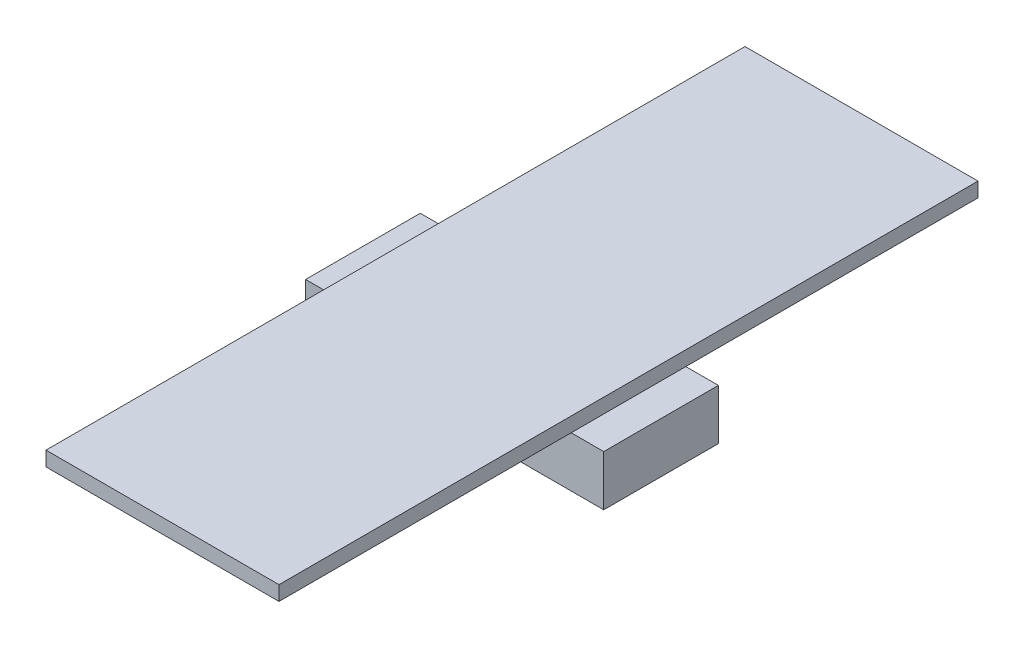
from build123d import *

# Parameters (mm, degrees)
SKETCH1_W           = 130
SKETCH1_H           = 50
BOSS_EXTRUDE1_DEPTH = 22
SKETCH2_RX          = 15.461746976
SKETCH2_RY          = 5.884694745
CUT_EXTRUDE1_DEPTH  = 85.905830189
SKETCH3_W           = 101.6
SKETCH3_H           = 304.8
BOSS_EXTRUDE2_DEPTH = 6.35


with BuildPart() as part:
    # Sketch1 → Boss-Extrude1 (new body)
    with BuildSketch(Plane(origin=(0, 0, 0), x_dir=(1, 0, 0), z_dir=(0, 1, 0))):
        Rectangle(SKETCH1_W, SKETCH1_H)
    extrude(amount=BOSS_EXTRUDE1_DEPTH)

    # Sketch2 → Cut-Extrude1 (cut, through all)
    with BuildSketch(Plane.XY.offset(25)):
        with Locations((0, 11)):
            Ellipse(SKETCH2_RX, SKETCH2_RY)
    extrude(amount=-CUT_EXTRUDE1_DEPTH, mode=Mode.SUBTRACT)

    # Sketch3 → Boss-Extrude2 (add)
    with BuildSketch(Plane(origin=(0, 22, 0), x_dir=(1, 0, 0), z_dir=(0, 1, 0))):
        Rectangle(SKETCH3_W, SKETCH3_H)
    extrude(amount=BOSS_EXTRUDE2_DEPTH)


solid = part.part
